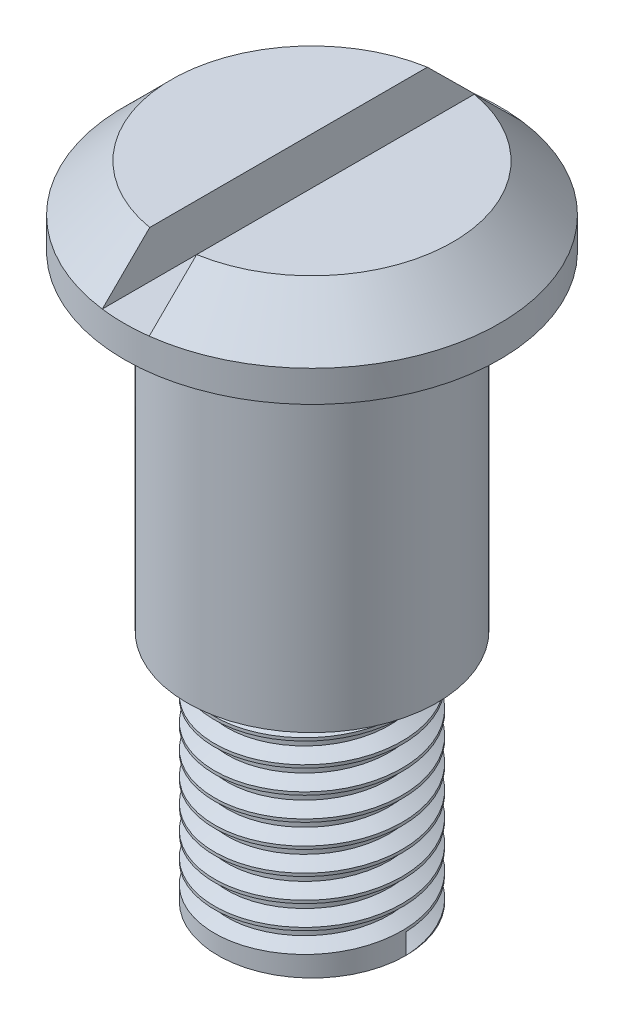
from build123d import *

# Parameters (mm, degrees)
SKETCH2_R               = 1.5
CUT_EXTRUDE1_DEPTH      = 3
THREAD1_PITCH           = 1.5
CUT_EXTRUDE2_DEPTH      = 47.183862945
CUT_EXTRUDE2_DEPTH_BACK = 47.183862945
SKETCH3_W               = 3
SKETCH3_H               = 3


with BuildPart() as part:
    # Sketch1 → Revolve1 (revolve)
    with BuildSketch(Plane(origin=(0, 0, 0), x_dir=(0, 0, -1), z_dir=(1, 0, 0))):
        Polygon((0, 1.952871808), (0, 39.952871808), (-12, 39.952871808), (-12, 37.952871808), (-8, 37.952871808), (-8, 16.952871808), (-6, 16.952871808), (-6, 1.952871808), align=None)
        Polygon((0, 39.952871808), (0, 42.952871808), (-9, 42.952871808), (-12, 39.952871808), align=None)
    revolve(axis=Axis((0, 60.886543616, 0), (0, -1, 0)))

    # Sketch2 → Cut-Extrude1 (cut)
    with BuildSketch(Plane(origin=(0, 42.952871808, 0), x_dir=(1, 0, 0), z_dir=(0, 1, 0))):
        with Locations(Location((0, 0, 0), (0, 0, 270))):
            Circle(SKETCH2_R)
    extrude(amount=-CUT_EXTRUDE1_DEPTH, mode=Mode.SUBTRACT)

    # Thread1: the profile of Thread Profile1 profile screwed along a right-hand helix of 10 turns, 8 arcs to a turn; built about Z, then put on its axis
    thread1_z = Axis((0, 0, 0), (0, 0, 1))
    thread1_corners = [(6.0003, 0, -0.000173205), (6.0003, 0, 1.312673201), (5.188101187, 0, 0.843749998), (5.188101187, 0, 0.468749998)]
    with BuildLine(mode=Mode.PRIVATE) as thread1_profile:
        Line(thread1_corners[0], thread1_corners[1])
        Line(thread1_corners[1], thread1_corners[2])
        Line(thread1_corners[2], thread1_corners[3])
        Line(thread1_corners[3], thread1_corners[0])
    thread1_cap = Face(thread1_profile.wire())
    thread1_turn_angles = [0, 22.5, 45, 67.5, 90, 112.5, 135, 157.5, 180, 202.5, 225, 247.5, 270, 292.5, 315, 337.5, 360]
    thread1_turn_weights = [1, 0.9238795325112867, 1, 0.9238795325112867, 1, 0.9238795325112867, 1, 0.9238795325112867, 1, 0.9238795325112867, 1, 0.9238795325112867, 1, 0.9238795325112867, 1, 0.9238795325112867, 1]
    thread1_turn_rails = [Edge.make_bspline([Vector(p[0], p[1], 0).rotate(thread1_z, thread1_turn_angles[k]) / thread1_turn_weights[k] + Vector(0, 0, p[2] + THREAD1_PITCH * thread1_turn_angles[k] / 360) for k in range(17)], [0, 0, 0, 1, 1, 2, 2, 3, 3, 4, 4, 5, 5, 6, 6, 7, 7, 8, 8, 8], 2, thread1_turn_weights) for p in thread1_corners]
    thread1_turn_sides = [Face.make_surface_from_curves(thread1_turn_rails[p[0]], thread1_turn_rails[p[1]]) for p in [(0, 1), (1, 2), (2, 3), (3, 0)]]
    thread1 = Plane(origin=(0, 1.952871808, 0), x_dir=(1, 0, 0), z_dir=(0, 1, 0)) * Solid(Shell([*[p.moved(Location((0, 0, THREAD1_PITCH * i))) for i in range(10) for p in thread1_turn_sides], thread1_cap, thread1_cap.rotate(thread1_z, 3600).moved(Location((0, 0, THREAD1_PITCH * 3600 / 360)))]))
    add(thread1, mode=Mode.SUBTRACT)

    # Sketch3 → Cut-Extrude2 (cut, two sides: drawn at the far end of the back side and taken through both)
    with BuildSketch(Plane.XY.offset(-CUT_EXTRUDE2_DEPTH_BACK)):
        with Locations((0, 41.452871808)):
            Rectangle(SKETCH3_W, SKETCH3_H)
    extrude(amount=CUT_EXTRUDE2_DEPTH + CUT_EXTRUDE2_DEPTH_BACK, mode=Mode.SUBTRACT)


solid = part.part
